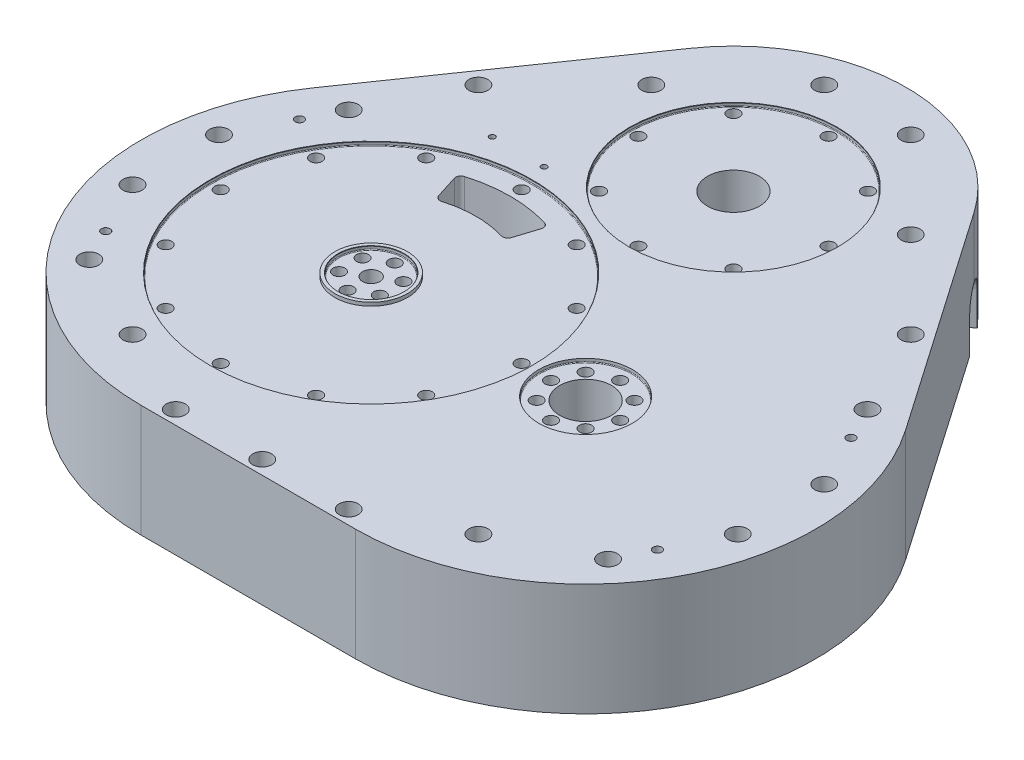
from build123d import *
from OCP.BRepFilletAPI import BRepFilletAPI_MakeChamfer

# Parameters (mm, degrees)
BOSS_EXTRUDE1_DEPTH                           = 63
BOSS_EXTRUDE2_START                           = -2
SKETCH1_4_R                                   = 93.00000000000004
SKETCH1_4_R_2                                 = 24.999999999999996
SKETCH1_4_R_3                                 = 60
SKETCH1_4_R_4                                 = 21.000000000000018
SKETCH1_4_R_5                                 = 19.00000000000001
BOSS_EXTRUDE2_DEPTH                           = 2
SKETCH2_R                                     = 14.999999999999998
SKETCH2_R_2                                   = 5.000000000000004
SKETCH2_R_3                                   = 15.000000000000014
CUT_EXTRUDE1_DEPTH                            = 281.1783027923315
M4_TAPPED_HOLE3_D                             = 3.3
M4_TAPPED_HOLE3_DEPTH                         = 11.5
M4_TAPPED_HOLE3_TIP                           = 0.9914200213954745
MOVE_FACE1_BY                                 = 30
MOVE_FACE1_2_BY                               = 30
MOVE_FACE1_3_BY                               = 30
MOVE_FACE1_4_BY                               = 30
MOVE_FACE1_5_BY                               = 30
MOVE_FACE1_6_BY                               = 30
CUT_EXTRUDE4_DEPTH                            = 30
CBORE_START                                   = -63
CBORE_FOR_M6_HEX_SOCKET_HEAD_CAP_SCR_2_R      = 3.5
CBORE_FOR_M6_HEX_SOCKET_HEAD_CAP_SCREW4_DEPTH = 65
CBORE_START_2                                 = -13
CBORE_FOR_M6_HEX_SOCKET_HEAD_CAP_SCR_3_O_R    = 5.5
CBORE_FOR_M6_HEX_SOCKET_HEAD_CAP_SCR_3_O_R_2  = 3.5
CBORE_FOR_M6_HEX_SOCKET_HEAD_CAP_SCR_3_DEPTH  = 15
CBORE_START_3                                 = -33
CBORE_FOR_M6_HEX_SOCKET_HEAD_CAP_SCR_4_R      = 3.5
CBORE_FOR_M6_HEX_SOCKET_HEAD_CAP_SCREW2_DEPTH = 33
CBORE_FOR_M6_HEX_SOCKET_HEAD_CAP_SCR_5_O_R    = 5.5
CBORE_FOR_M6_HEX_SOCKET_HEAD_CAP_SCR_5_O_R_2  = 3.5
CBORE_FOR_M6_HEX_SOCKET_HEAD_CAP_SCR_5_DEPTH  = 6.4
CUT_EXTRUDE5_DEPTH                            = 30
FILLET1_R                                     = 10
SKETCH25_R                                    = 19.999999999999993
CUT_EXTRUDE7_DEPTH                            = 6.4
M6_TAPPED_HOLE1_D                             = 5
M6_TAPPED_HOLE1_DEPTH                         = 15
M6_TAPPED_HOLE1_TIP                           = 1.5021515475689007
MOVE_FACE3_BY                                 = 2
FILLET3_R                                     = 0.4
CHAMFER2_SIZE                                 = 0.2
CHAMFER2_SIZE2                                = 0.11547005383792547


# Read off the part's stored shape, not the designer's step: CBORE for M6 Hex Socket Head Cap Screw4, CBORE for M6 Hex Socket Head Cap Screw2
with BuildPart() as part:
    # Sketch1 → Boss-Extrude1 (new body)
    with BuildSketch(Plane(origin=(0, 0, 0), x_dir=(1, 0, 0), z_dir=(0, 1, 0))):
        with BuildLine():
            Line((62.000000000000014, -103.00000000000001), (-61.99999999999998, -103.00000000000003))
            ThreePointArc((-61.99999999999998, -103.00000000000003), (-153.23800570835385, -47.79776474232239), (-146.67908218265174, 58.6383239929633))
            Line((-146.67908218265174, 58.6383239929633), (-57.54889080374385, 187.3504406904959))
            ThreePointArc((-57.54889080374385, 187.3504406904959), (4.29e-15, 217.4991525399384), (57.54889080374384, 187.35044069049587))
            Line((57.54889080374384, 187.35044069049587), (146.67908218265168, 58.63832399296319))
            ThreePointArc((146.67908218265168, 58.63832399296319), (153.23800570835382, -47.79776474232238), (62.000000000000014, -103.00000000000001))
        make_face()
        with BuildLine():
            Line((83.01492141423115, 59.99979648260452), (87.21019324490341, 73.30549881526593))
            ThreePointArc((87.21019324490341, 73.30549881526593), (87.00108225288031, 75.61000153165534), (85.21416661430999, 77.08016909947331))
            ThreePointArc((85.21416661430999, 77.08016909947331), (61.999999999999424, 80.50000000000223), (38.78583338568891, 77.08016909947298))
            ThreePointArc((38.78583338568891, 77.08016909947298), (36.99891774711863, 75.61000153165499), (36.78980675509557, 73.3054988152656))
            Line((36.78980675509557, 73.3054988152656), (40.985078585768015, 59.99979648260422))
            ThreePointArc((40.985078585768015, 59.99979648260422), (42.440089302349584, 58.25186295351636), (44.70321309947552, 58.026921880435))
            ThreePointArc((44.70321309947552, 58.026921880435), (61.99999999999958, 60.550000000002264), (79.29678690052367, 58.02692188043525))
            ThreePointArc((79.29678690052367, 58.02692188043525), (81.55991069764961, 58.25186295351663), (83.01492141423115, 59.99979648260452))
        make_face(mode=Mode.SUBTRACT)
    extrude(amount=BOSS_EXTRUDE1_DEPTH)

    # Sketch1<4> → Boss-Extrude2 (add)
    # profile 1 of 2: a face of its own
    with BuildSketch(Plane(origin=(0, 0, 0), x_dir=(1, 0, 0), z_dir=(0, 1, 0)).offset(BOSS_EXTRUDE2_START)):
        with BuildLine():
            ThreePointArc((-57.54889080374385, 187.3504406904959), (4.29e-15, 217.4991525399384), (57.54889080374384, 187.35044069049587))
            Line((57.54889080374384, 187.35044069049587), (146.67908218265168, 58.63832399296319))
            ThreePointArc((146.67908218265168, 58.63832399296319), (153.23800570835382, -47.79776474232238), (62.000000000000014, -103.00000000000001))
            Line((62.000000000000014, -103.00000000000001), (-61.99999999999998, -103.00000000000003))
            ThreePointArc((-61.99999999999998, -103.00000000000003), (-153.23800570835385, -47.79776474232239), (-146.67908218265174, 58.6383239929633))
            Line((-146.67908218265174, 58.6383239929633), (-57.54889080374385, 187.3504406904959))
        make_face()
        with Locations(Location((62, 0, 0), (0, 0, 270))):
            Circle(SKETCH1_4_R, mode=Mode.SUBTRACT)
        with Locations(Location((-61.99999999999999, 6.13e-15, 0), (0, 0, 270))):
            Circle(SKETCH1_4_R_2, mode=Mode.SUBTRACT)
        with Locations(Location((0, 147.49915253993836, 0), (0, 0, 270))):
            Circle(SKETCH1_4_R_3, mode=Mode.SUBTRACT)
    # profile 2 of 2: a face of its own
    with BuildSketch(Plane(origin=(0, 0, 0), x_dir=(1, 0, 0), z_dir=(0, 1, 0)).offset(BOSS_EXTRUDE2_START)):
        with Locations(Location((62, 0, 0), (0, 0, 270))):
            Circle(SKETCH1_4_R_4)
        with Locations(Location((62, 0, 0), (0, 0, 270))):
            Circle(SKETCH1_4_R_5, mode=Mode.SUBTRACT)
    extrude(amount=BOSS_EXTRUDE2_DEPTH)

    # Sketch2 → Cut-Extrude1 (cut, through all)
    with BuildSketch(Plane(origin=(0, 0, 0), x_dir=(1, 0, 0), z_dir=(0, 1, 0))):
        with Locations(Location((-62.00000000000001, 3.79e-15, 0), (0, 0, 270))):
            Circle(SKETCH2_R)
        with Locations(Location((62, 0, 0), (0, 0, 270))):
            Circle(SKETCH2_R_2)
        with Locations(Location((0, 147.49915253993836, 0), (0, 0, 270))):
            Circle(SKETCH2_R_3)
    extrude(amount=CUT_EXTRUDE1_DEPTH, mode=Mode.SUBTRACT)

    # M4 Tapped Hole3
    with Locations(Plane(origin=(0, -2, 0), x_dir=(-1, 0, 0), z_dir=(0, -1, 0))):
        with Locations((-65, 103), (-95, 103)):
            Hole(M4_TAPPED_HOLE3_D / 2, depth=M4_TAPPED_HOLE3_DEPTH)
            with Locations((0, 0, -(M4_TAPPED_HOLE3_DEPTH + M4_TAPPED_HOLE3_TIP / 2))):  # 118° drill point
                Cone(0, M4_TAPPED_HOLE3_D / 2, M4_TAPPED_HOLE3_TIP, mode=Mode.SUBTRACT)


with BuildPart() as body_2:
    # Mirror1: mirrored copy
    add(part.part.mirror(Plane(origin=(0, 0, 0), x_dir=(0, 0, 1), z_dir=(1, 0, 0))))


with BuildPart() as body_3:
    # Mirror2: mirrored copy
    add(body_2.part.mirror(Plane.ZX))

    # Move Face1: a curved face moved outward by 30.0
    add(Solid.thicken(body_3.faces().sort_by_distance((-153.238005708, -30.5, 47.797764742))[0], MOVE_FACE1_BY))

    # Move Face1 2: a face moved outward by 30.0
    extrude(body_3.faces().sort_by_distance((0, -30.5, 103))[0], amount=MOVE_FACE1_2_BY, dir=(0, 0, 1))

    # Move Face1 3: a curved face moved outward by 30.0
    add(Solid.thicken(body_3.faces().sort_by_distance((153.238005708, -30.5, 47.797764742))[0], MOVE_FACE1_3_BY))

    # Move Face1 4: a face moved outward by 30.0
    extrude(body_3.faces().sort_by_distance((102.113986493, -30.5, -122.994382342))[0], amount=MOVE_FACE1_4_BY, dir=(0.822127011, 0, -0.569304116))

    # Move Face1 5: a curved face moved outward by 30.0
    add(Solid.thicken(body_3.faces().sort_by_distance((0, -30.5, -217.49915254))[0], MOVE_FACE1_5_BY))

    # Move Face1 6: a face moved outward by 30.0
    extrude(body_3.faces().sort_by_distance((-102.113986493, -30.5, -122.994382342))[0], amount=MOVE_FACE1_6_BY, dir=(-0.822127011, 0, -0.569304116))

    # Sketch21 → Cut-Extrude4 (cut)
    with BuildSketch(Plane.XZ.offset(63)):
        with BuildLine():
            Line((-57.548890803743824, -187.35044069049584), (-146.67908218265174, -58.638323992963166))
            ThreePointArc((-146.67908218265174, -58.638323992963166), (-153.23800570835382, 47.797764742322386), (-62.000000000000014, 103.00000000000001))
            Line((-62.000000000000014, 103.00000000000001), (62.00000000000004, 103.00000000000001))
            ThreePointArc((62.00000000000004, 103.00000000000001), (153.2380057083539, 47.79776474232241), (146.67908218265174, -58.638323992963244))
            Line((146.67908218265174, -58.638323992963244), (57.548890803743845, -187.3504406904959))
            ThreePointArc((57.548890803743845, -187.3504406904959), (-2.68e-14, -217.49915253993834), (-57.548890803743824, -187.35044069049584))
        make_face()
    extrude(amount=-CUT_EXTRUDE4_DEPTH, mode=Mode.SUBTRACT)

    # CBORE for M6 Hex Socket Head Cap Scr 2 → CBORE for M6 Hex Socket Head Cap Screw4 (cut)
    with BuildSketch(Plane(origin=(0, 0, 0), x_dir=(1, 0, 0), z_dir=(0, 1, 0)).offset(CBORE_START)):
        with Locations((25, 225)):
            Circle(CBORE_FOR_M6_HEX_SOCKET_HEAD_CAP_SCR_2_R)
        with Locations((-25, 225)):
            Circle(CBORE_FOR_M6_HEX_SOCKET_HEAD_CAP_SCR_2_R)
        with Locations((-175, 25)):
            Circle(CBORE_FOR_M6_HEX_SOCKET_HEAD_CAP_SCR_2_R)
        with Locations((-175, -25)):
            Circle(CBORE_FOR_M6_HEX_SOCKET_HEAD_CAP_SCR_2_R)
        with Locations((75, 175)):
            Circle(CBORE_FOR_M6_HEX_SOCKET_HEAD_CAP_SCR_2_R)
        with Locations((-75, 175)):
            Circle(CBORE_FOR_M6_HEX_SOCKET_HEAD_CAP_SCR_2_R)
        with Locations((125, 125)):
            Circle(CBORE_FOR_M6_HEX_SOCKET_HEAD_CAP_SCR_2_R)
        with Locations((-125, 125)):
            Circle(CBORE_FOR_M6_HEX_SOCKET_HEAD_CAP_SCR_2_R)
        with Locations((150, 75)):
            Circle(CBORE_FOR_M6_HEX_SOCKET_HEAD_CAP_SCR_2_R)
        with Locations((-150, 75)):
            Circle(CBORE_FOR_M6_HEX_SOCKET_HEAD_CAP_SCR_2_R)
        with Locations((175, 25)):
            Circle(CBORE_FOR_M6_HEX_SOCKET_HEAD_CAP_SCR_2_R)
        with Locations((175, -25)):
            Circle(CBORE_FOR_M6_HEX_SOCKET_HEAD_CAP_SCR_2_R)
        with Locations((150, -75)):
            Circle(CBORE_FOR_M6_HEX_SOCKET_HEAD_CAP_SCR_2_R)
        with Locations((-150, -75)):
            Circle(CBORE_FOR_M6_HEX_SOCKET_HEAD_CAP_SCR_2_R)
        with Locations((100, -100)):
            Circle(CBORE_FOR_M6_HEX_SOCKET_HEAD_CAP_SCR_2_R)
        with Locations((-100, -100)):
            Circle(CBORE_FOR_M6_HEX_SOCKET_HEAD_CAP_SCR_2_R)
        with Locations((50, -125)):
            Circle(CBORE_FOR_M6_HEX_SOCKET_HEAD_CAP_SCR_2_R)
        with Locations((0, -125)):
            Circle(CBORE_FOR_M6_HEX_SOCKET_HEAD_CAP_SCR_2_R)
        with Locations((-50, -125)):
            Circle(CBORE_FOR_M6_HEX_SOCKET_HEAD_CAP_SCR_2_R)
    extrude(amount=CBORE_FOR_M6_HEX_SOCKET_HEAD_CAP_SCREW4_DEPTH, mode=Mode.SUBTRACT)

    # CBORE for M6 Hex Socket Head Cap Scr 3 o → CBORE for M6 Hex Socket Head Cap Scr 3 (cut)
    # profile 1 of 19: a face of its own
    with BuildSketch(Plane(origin=(0, 0, 0), x_dir=(1, 0, 0), z_dir=(0, 1, 0)).offset(CBORE_START_2)):
        with Locations((25, 225)):
            Circle(CBORE_FOR_M6_HEX_SOCKET_HEAD_CAP_SCR_3_O_R)
        with Locations((25, 225)):
            Circle(CBORE_FOR_M6_HEX_SOCKET_HEAD_CAP_SCR_3_O_R_2, mode=Mode.SUBTRACT)
    # profile 2 of 19: a face of its own
    with BuildSketch(Plane(origin=(0, 0, 0), x_dir=(1, 0, 0), z_dir=(0, 1, 0)).offset(CBORE_START_2)):
        with Locations((-25, 225)):
            Circle(CBORE_FOR_M6_HEX_SOCKET_HEAD_CAP_SCR_3_O_R)
        with Locations((-25, 225)):
            Circle(CBORE_FOR_M6_HEX_SOCKET_HEAD_CAP_SCR_3_O_R_2, mode=Mode.SUBTRACT)
    # profile 3 of 19: a face of its own
    with BuildSketch(Plane(origin=(0, 0, 0), x_dir=(1, 0, 0), z_dir=(0, 1, 0)).offset(CBORE_START_2)):
        with Locations((-175, 25)):
            Circle(CBORE_FOR_M6_HEX_SOCKET_HEAD_CAP_SCR_3_O_R)
        with Locations((-175, 25)):
            Circle(CBORE_FOR_M6_HEX_SOCKET_HEAD_CAP_SCR_3_O_R_2, mode=Mode.SUBTRACT)
    # profile 4 of 19: a face of its own
    with BuildSketch(Plane(origin=(0, 0, 0), x_dir=(1, 0, 0), z_dir=(0, 1, 0)).offset(CBORE_START_2)):
        with Locations((-175, -25)):
            Circle(CBORE_FOR_M6_HEX_SOCKET_HEAD_CAP_SCR_3_O_R)
        with Locations((-175, -25)):
            Circle(CBORE_FOR_M6_HEX_SOCKET_HEAD_CAP_SCR_3_O_R_2, mode=Mode.SUBTRACT)
    # profile 5 of 19: a face of its own
    with BuildSketch(Plane(origin=(0, 0, 0), x_dir=(1, 0, 0), z_dir=(0, 1, 0)).offset(CBORE_START_2)):
        with Locations((75, 175)):
            Circle(CBORE_FOR_M6_HEX_SOCKET_HEAD_CAP_SCR_3_O_R)
        with Locations((75, 175)):
            Circle(CBORE_FOR_M6_HEX_SOCKET_HEAD_CAP_SCR_3_O_R_2, mode=Mode.SUBTRACT)
    # profile 6 of 19: a face of its own
    with BuildSketch(Plane(origin=(0, 0, 0), x_dir=(1, 0, 0), z_dir=(0, 1, 0)).offset(CBORE_START_2)):
        with Locations((-75, 175)):
            Circle(CBORE_FOR_M6_HEX_SOCKET_HEAD_CAP_SCR_3_O_R)
        with Locations((-75, 175)):
            Circle(CBORE_FOR_M6_HEX_SOCKET_HEAD_CAP_SCR_3_O_R_2, mode=Mode.SUBTRACT)
    # profile 7 of 19: a face of its own
    with BuildSketch(Plane(origin=(0, 0, 0), x_dir=(1, 0, 0), z_dir=(0, 1, 0)).offset(CBORE_START_2)):
        with Locations((125, 125)):
            Circle(CBORE_FOR_M6_HEX_SOCKET_HEAD_CAP_SCR_3_O_R)
        with Locations((125, 125)):
            Circle(CBORE_FOR_M6_HEX_SOCKET_HEAD_CAP_SCR_3_O_R_2, mode=Mode.SUBTRACT)
    # profile 8 of 19: a face of its own
    with BuildSketch(Plane(origin=(0, 0, 0), x_dir=(1, 0, 0), z_dir=(0, 1, 0)).offset(CBORE_START_2)):
        with Locations((-125, 125)):
            Circle(CBORE_FOR_M6_HEX_SOCKET_HEAD_CAP_SCR_3_O_R)
        with Locations((-125, 125)):
            Circle(CBORE_FOR_M6_HEX_SOCKET_HEAD_CAP_SCR_3_O_R_2, mode=Mode.SUBTRACT)
    # profile 9 of 19: a face of its own
    with BuildSketch(Plane(origin=(0, 0, 0), x_dir=(1, 0, 0), z_dir=(0, 1, 0)).offset(CBORE_START_2)):
        with Locations((150, 75)):
            Circle(CBORE_FOR_M6_HEX_SOCKET_HEAD_CAP_SCR_3_O_R)
        with Locations((150, 75)):
            Circle(CBORE_FOR_M6_HEX_SOCKET_HEAD_CAP_SCR_3_O_R_2, mode=Mode.SUBTRACT)
    # profile 10 of 19: a face of its own
    with BuildSketch(Plane(origin=(0, 0, 0), x_dir=(1, 0, 0), z_dir=(0, 1, 0)).offset(CBORE_START_2)):
        with Locations((-150, 75)):
            Circle(CBORE_FOR_M6_HEX_SOCKET_HEAD_CAP_SCR_3_O_R)
        with Locations((-150, 75)):
            Circle(CBORE_FOR_M6_HEX_SOCKET_HEAD_CAP_SCR_3_O_R_2, mode=Mode.SUBTRACT)
    # profile 11 of 19: a face of its own
    with BuildSketch(Plane(origin=(0, 0, 0), x_dir=(1, 0, 0), z_dir=(0, 1, 0)).offset(CBORE_START_2)):
        with Locations((175, 25)):
            Circle(CBORE_FOR_M6_HEX_SOCKET_HEAD_CAP_SCR_3_O_R)
        with Locations((175, 25)):
            Circle(CBORE_FOR_M6_HEX_SOCKET_HEAD_CAP_SCR_3_O_R_2, mode=Mode.SUBTRACT)
    # profile 12 of 19: a face of its own
    with BuildSketch(Plane(origin=(0, 0, 0), x_dir=(1, 0, 0), z_dir=(0, 1, 0)).offset(CBORE_START_2)):
        with Locations((175, -25)):
            Circle(CBORE_FOR_M6_HEX_SOCKET_HEAD_CAP_SCR_3_O_R)
        with Locations((175, -25)):
            Circle(CBORE_FOR_M6_HEX_SOCKET_HEAD_CAP_SCR_3_O_R_2, mode=Mode.SUBTRACT)
    # profile 13 of 19: a face of its own
    with BuildSketch(Plane(origin=(0, 0, 0), x_dir=(1, 0, 0), z_dir=(0, 1, 0)).offset(CBORE_START_2)):
        with Locations((150, -75)):
            Circle(CBORE_FOR_M6_HEX_SOCKET_HEAD_CAP_SCR_3_O_R)
        with Locations((150, -75)):
            Circle(CBORE_FOR_M6_HEX_SOCKET_HEAD_CAP_SCR_3_O_R_2, mode=Mode.SUBTRACT)
    # profile 14 of 19: a face of its own
    with BuildSketch(Plane(origin=(0, 0, 0), x_dir=(1, 0, 0), z_dir=(0, 1, 0)).offset(CBORE_START_2)):
        with Locations((-150, -75)):
            Circle(CBORE_FOR_M6_HEX_SOCKET_HEAD_CAP_SCR_3_O_R)
        with Locations((-150, -75)):
            Circle(CBORE_FOR_M6_HEX_SOCKET_HEAD_CAP_SCR_3_O_R_2, mode=Mode.SUBTRACT)
    # profile 15 of 19: a face of its own
    with BuildSketch(Plane(origin=(0, 0, 0), x_dir=(1, 0, 0), z_dir=(0, 1, 0)).offset(CBORE_START_2)):
        with Locations((100, -100)):
            Circle(CBORE_FOR_M6_HEX_SOCKET_HEAD_CAP_SCR_3_O_R)
        with Locations((100, -100)):
            Circle(CBORE_FOR_M6_HEX_SOCKET_HEAD_CAP_SCR_3_O_R_2, mode=Mode.SUBTRACT)
    # profile 16 of 19: a face of its own
    with BuildSketch(Plane(origin=(0, 0, 0), x_dir=(1, 0, 0), z_dir=(0, 1, 0)).offset(CBORE_START_2)):
        with Locations((-100, -100)):
            Circle(CBORE_FOR_M6_HEX_SOCKET_HEAD_CAP_SCR_3_O_R)
        with Locations((-100, -100)):
            Circle(CBORE_FOR_M6_HEX_SOCKET_HEAD_CAP_SCR_3_O_R_2, mode=Mode.SUBTRACT)
    # profile 17 of 19: a face of its own
    with BuildSketch(Plane(origin=(0, 0, 0), x_dir=(1, 0, 0), z_dir=(0, 1, 0)).offset(CBORE_START_2)):
        with Locations((50, -125)):
            Circle(CBORE_FOR_M6_HEX_SOCKET_HEAD_CAP_SCR_3_O_R)
        with Locations((50, -125)):
            Circle(CBORE_FOR_M6_HEX_SOCKET_HEAD_CAP_SCR_3_O_R_2, mode=Mode.SUBTRACT)
    # profile 18 of 19: a face of its own
    with BuildSketch(Plane(origin=(0, 0, 0), x_dir=(1, 0, 0), z_dir=(0, 1, 0)).offset(CBORE_START_2)):
        with Locations((0, -125)):
            Circle(CBORE_FOR_M6_HEX_SOCKET_HEAD_CAP_SCR_3_O_R)
        with Locations((0, -125)):
            Circle(CBORE_FOR_M6_HEX_SOCKET_HEAD_CAP_SCR_3_O_R_2, mode=Mode.SUBTRACT)
    # profile 19 of 19: a face of its own
    with BuildSketch(Plane(origin=(0, 0, 0), x_dir=(1, 0, 0), z_dir=(0, 1, 0)).offset(CBORE_START_2)):
        with Locations((-50, -125)):
            Circle(CBORE_FOR_M6_HEX_SOCKET_HEAD_CAP_SCR_3_O_R)
        with Locations((-50, -125)):
            Circle(CBORE_FOR_M6_HEX_SOCKET_HEAD_CAP_SCR_3_O_R_2, mode=Mode.SUBTRACT)
    extrude(amount=CBORE_FOR_M6_HEX_SOCKET_HEAD_CAP_SCR_3_DEPTH, mode=Mode.SUBTRACT)

    # CBORE for M6 Hex Socket Head Cap Scr 4 → CBORE for M6 Hex Socket Head Cap Screw2 (cut)
    with BuildSketch(Plane(origin=(0, 0, 0), x_dir=(1, 0, 0), z_dir=(0, 1, 0)).offset(CBORE_START_3)):
        with Locations((0, 202.49915254)):
            Circle(CBORE_FOR_M6_HEX_SOCKET_HEAD_CAP_SCR_4_R)
        with Locations((38.890872965, 186.390025505)):
            Circle(CBORE_FOR_M6_HEX_SOCKET_HEAD_CAP_SCR_4_R)
        with Locations((55, 147.49915254)):
            Circle(CBORE_FOR_M6_HEX_SOCKET_HEAD_CAP_SCR_4_R)
        with Locations((38.890872965, 108.608279575)):
            Circle(CBORE_FOR_M6_HEX_SOCKET_HEAD_CAP_SCR_4_R)
        with Locations((0, 92.49915254)):
            Circle(CBORE_FOR_M6_HEX_SOCKET_HEAD_CAP_SCR_4_R)
        with Locations((-38.890872965, 108.608279575)):
            Circle(CBORE_FOR_M6_HEX_SOCKET_HEAD_CAP_SCR_4_R)
        with Locations((-55, 147.49915254)):
            Circle(CBORE_FOR_M6_HEX_SOCKET_HEAD_CAP_SCR_4_R)
        with Locations((-38.890872965, 186.390025505)):
            Circle(CBORE_FOR_M6_HEX_SOCKET_HEAD_CAP_SCR_4_R)
        with Locations((13.344210129, 43.5)):
            Circle(CBORE_FOR_M6_HEX_SOCKET_HEAD_CAP_SCR_4_R)
        with Locations((-18.5, 75.344210129)):
            Circle(CBORE_FOR_M6_HEX_SOCKET_HEAD_CAP_SCR_4_R)
        with Locations((25, 0)):
            Circle(CBORE_FOR_M6_HEX_SOCKET_HEAD_CAP_SCR_4_R)
        with Locations((13.344210129, -43.5)):
            Circle(CBORE_FOR_M6_HEX_SOCKET_HEAD_CAP_SCR_4_R)
        with Locations((-18.5, -75.344210129)):
            Circle(CBORE_FOR_M6_HEX_SOCKET_HEAD_CAP_SCR_4_R)
        with Locations((-62, -87)):
            Circle(CBORE_FOR_M6_HEX_SOCKET_HEAD_CAP_SCR_4_R)
        with Locations((-105.5, -75.344210129)):
            Circle(CBORE_FOR_M6_HEX_SOCKET_HEAD_CAP_SCR_4_R)
        with Locations((-62, 87)):
            Circle(CBORE_FOR_M6_HEX_SOCKET_HEAD_CAP_SCR_4_R)
        with Locations((-105.5, 75.344210129)):
            Circle(CBORE_FOR_M6_HEX_SOCKET_HEAD_CAP_SCR_4_R)
        with Locations((-137.344210129, -43.5)):
            Circle(CBORE_FOR_M6_HEX_SOCKET_HEAD_CAP_SCR_4_R)
        with Locations((-149, 0)):
            Circle(CBORE_FOR_M6_HEX_SOCKET_HEAD_CAP_SCR_4_R)
        with Locations((-137.344210129, 43.5)):
            Circle(CBORE_FOR_M6_HEX_SOCKET_HEAD_CAP_SCR_4_R)
        with Locations((-73.7966538, -6.810801247)):
            Circle(CBORE_FOR_M6_HEX_SOCKET_HEAD_CAP_SCR_4_R)
        with Locations((-62, -13.621602494)):
            Circle(CBORE_FOR_M6_HEX_SOCKET_HEAD_CAP_SCR_4_R)
        with Locations((-50.2033462, -6.810801247)):
            Circle(CBORE_FOR_M6_HEX_SOCKET_HEAD_CAP_SCR_4_R)
        with Locations((-50.2033462, 6.810801247)):
            Circle(CBORE_FOR_M6_HEX_SOCKET_HEAD_CAP_SCR_4_R)
        with Locations((-62, 13.621602494)):
            Circle(CBORE_FOR_M6_HEX_SOCKET_HEAD_CAP_SCR_4_R)
        with Locations((-73.7966538, 6.810801247)):
            Circle(CBORE_FOR_M6_HEX_SOCKET_HEAD_CAP_SCR_4_R)
        with Locations((47.857864376, -14.142135624)):
            Circle(CBORE_FOR_M6_HEX_SOCKET_HEAD_CAP_SCR_4_R)
        with Locations((62, -20)):
            Circle(CBORE_FOR_M6_HEX_SOCKET_HEAD_CAP_SCR_4_R)
        with Locations((76.142135624, -14.142135624)):
            Circle(CBORE_FOR_M6_HEX_SOCKET_HEAD_CAP_SCR_4_R)
        with Locations((82, 0)):
            Circle(CBORE_FOR_M6_HEX_SOCKET_HEAD_CAP_SCR_4_R)
        with Locations((76.142135624, 14.142135624)):
            Circle(CBORE_FOR_M6_HEX_SOCKET_HEAD_CAP_SCR_4_R)
        with Locations((62, 20)):
            Circle(CBORE_FOR_M6_HEX_SOCKET_HEAD_CAP_SCR_4_R)
        with Locations((47.857864376, 14.142135624)):
            Circle(CBORE_FOR_M6_HEX_SOCKET_HEAD_CAP_SCR_4_R)
        with Locations((42, 0)):
            Circle(CBORE_FOR_M6_HEX_SOCKET_HEAD_CAP_SCR_4_R)
    extrude(amount=CBORE_FOR_M6_HEX_SOCKET_HEAD_CAP_SCREW2_DEPTH, mode=Mode.SUBTRACT)

    # CBORE for M6 Hex Socket Head Cap Scr 5 o → CBORE for M6 Hex Socket Head Cap Scr 5 (cut)
    # profile 1 of 34: a face of its own
    with BuildSketch(Plane(origin=(0, 0, 0), x_dir=(1, 0, 0), z_dir=(0, 1, 0)).offset(CBORE_START_3)):
        with Locations((0, 202.49915254)):
            Circle(CBORE_FOR_M6_HEX_SOCKET_HEAD_CAP_SCR_5_O_R)
        with Locations((0, 202.49915254)):
            Circle(CBORE_FOR_M6_HEX_SOCKET_HEAD_CAP_SCR_5_O_R_2, mode=Mode.SUBTRACT)
    # profile 2 of 34: a face of its own
    with BuildSketch(Plane(origin=(0, 0, 0), x_dir=(1, 0, 0), z_dir=(0, 1, 0)).offset(CBORE_START_3)):
        with Locations((38.890872965, 186.390025505)):
            Circle(CBORE_FOR_M6_HEX_SOCKET_HEAD_CAP_SCR_5_O_R)
        with Locations((38.890872965, 186.390025505)):
            Circle(CBORE_FOR_M6_HEX_SOCKET_HEAD_CAP_SCR_5_O_R_2, mode=Mode.SUBTRACT)
    # profile 3 of 34: a face of its own
    with BuildSketch(Plane(origin=(0, 0, 0), x_dir=(1, 0, 0), z_dir=(0, 1, 0)).offset(CBORE_START_3)):
        with Locations((55, 147.49915254)):
            Circle(CBORE_FOR_M6_HEX_SOCKET_HEAD_CAP_SCR_5_O_R)
        with Locations((55, 147.49915254)):
            Circle(CBORE_FOR_M6_HEX_SOCKET_HEAD_CAP_SCR_5_O_R_2, mode=Mode.SUBTRACT)
    # profile 4 of 34: a face of its own
    with BuildSketch(Plane(origin=(0, 0, 0), x_dir=(1, 0, 0), z_dir=(0, 1, 0)).offset(CBORE_START_3)):
        with Locations((38.890872965, 108.608279575)):
            Circle(CBORE_FOR_M6_HEX_SOCKET_HEAD_CAP_SCR_5_O_R)
        with Locations((38.890872965, 108.608279575)):
            Circle(CBORE_FOR_M6_HEX_SOCKET_HEAD_CAP_SCR_5_O_R_2, mode=Mode.SUBTRACT)
    # profile 5 of 34: a face of its own
    with BuildSketch(Plane(origin=(0, 0, 0), x_dir=(1, 0, 0), z_dir=(0, 1, 0)).offset(CBORE_START_3)):
        with Locations((0, 92.49915254)):
            Circle(CBORE_FOR_M6_HEX_SOCKET_HEAD_CAP_SCR_5_O_R)
        with Locations((0, 92.49915254)):
            Circle(CBORE_FOR_M6_HEX_SOCKET_HEAD_CAP_SCR_5_O_R_2, mode=Mode.SUBTRACT)
    # profile 6 of 34: a face of its own
    with BuildSketch(Plane(origin=(0, 0, 0), x_dir=(1, 0, 0), z_dir=(0, 1, 0)).offset(CBORE_START_3)):
        with Locations((-38.890872965, 108.608279575)):
            Circle(CBORE_FOR_M6_HEX_SOCKET_HEAD_CAP_SCR_5_O_R)
        with Locations((-38.890872965, 108.608279575)):
            Circle(CBORE_FOR_M6_HEX_SOCKET_HEAD_CAP_SCR_5_O_R_2, mode=Mode.SUBTRACT)
    # profile 7 of 34: a face of its own
    with BuildSketch(Plane(origin=(0, 0, 0), x_dir=(1, 0, 0), z_dir=(0, 1, 0)).offset(CBORE_START_3)):
        with Locations((-55, 147.49915254)):
            Circle(CBORE_FOR_M6_HEX_SOCKET_HEAD_CAP_SCR_5_O_R)
        with Locations((-55, 147.49915254)):
            Circle(CBORE_FOR_M6_HEX_SOCKET_HEAD_CAP_SCR_5_O_R_2, mode=Mode.SUBTRACT)
    # profile 8 of 34: a face of its own
    with BuildSketch(Plane(origin=(0, 0, 0), x_dir=(1, 0, 0), z_dir=(0, 1, 0)).offset(CBORE_START_3)):
        with Locations((-38.890872965, 186.390025505)):
            Circle(CBORE_FOR_M6_HEX_SOCKET_HEAD_CAP_SCR_5_O_R)
        with Locations((-38.890872965, 186.390025505)):
            Circle(CBORE_FOR_M6_HEX_SOCKET_HEAD_CAP_SCR_5_O_R_2, mode=Mode.SUBTRACT)
    # profile 9 of 34: a face of its own
    with BuildSketch(Plane(origin=(0, 0, 0), x_dir=(1, 0, 0), z_dir=(0, 1, 0)).offset(CBORE_START_3)):
        with Locations((13.344210129, 43.5)):
            Circle(CBORE_FOR_M6_HEX_SOCKET_HEAD_CAP_SCR_5_O_R)
        with Locations((13.344210129, 43.5)):
            Circle(CBORE_FOR_M6_HEX_SOCKET_HEAD_CAP_SCR_5_O_R_2, mode=Mode.SUBTRACT)
    # profile 10 of 34: a face of its own
    with BuildSketch(Plane(origin=(0, 0, 0), x_dir=(1, 0, 0), z_dir=(0, 1, 0)).offset(CBORE_START_3)):
        with Locations((-18.5, 75.344210129)):
            Circle(CBORE_FOR_M6_HEX_SOCKET_HEAD_CAP_SCR_5_O_R)
        with Locations((-18.5, 75.344210129)):
            Circle(CBORE_FOR_M6_HEX_SOCKET_HEAD_CAP_SCR_5_O_R_2, mode=Mode.SUBTRACT)
    # profile 11 of 34: a face of its own
    with BuildSketch(Plane(origin=(0, 0, 0), x_dir=(1, 0, 0), z_dir=(0, 1, 0)).offset(CBORE_START_3)):
        with Locations((25, 0)):
            Circle(CBORE_FOR_M6_HEX_SOCKET_HEAD_CAP_SCR_5_O_R)
        with Locations((25, 0)):
            Circle(CBORE_FOR_M6_HEX_SOCKET_HEAD_CAP_SCR_5_O_R_2, mode=Mode.SUBTRACT)
    # profile 12 of 34: a face of its own
    with BuildSketch(Plane(origin=(0, 0, 0), x_dir=(1, 0, 0), z_dir=(0, 1, 0)).offset(CBORE_START_3)):
        with Locations((13.344210129, -43.5)):
            Circle(CBORE_FOR_M6_HEX_SOCKET_HEAD_CAP_SCR_5_O_R)
        with Locations((13.344210129, -43.5)):
            Circle(CBORE_FOR_M6_HEX_SOCKET_HEAD_CAP_SCR_5_O_R_2, mode=Mode.SUBTRACT)
    # profile 13 of 34: a face of its own
    with BuildSketch(Plane(origin=(0, 0, 0), x_dir=(1, 0, 0), z_dir=(0, 1, 0)).offset(CBORE_START_3)):
        with Locations((-18.5, -75.344210129)):
            Circle(CBORE_FOR_M6_HEX_SOCKET_HEAD_CAP_SCR_5_O_R)
        with Locations((-18.5, -75.344210129)):
            Circle(CBORE_FOR_M6_HEX_SOCKET_HEAD_CAP_SCR_5_O_R_2, mode=Mode.SUBTRACT)
    # profile 14 of 34: a face of its own
    with BuildSketch(Plane(origin=(0, 0, 0), x_dir=(1, 0, 0), z_dir=(0, 1, 0)).offset(CBORE_START_3)):
        with Locations((-62, -87)):
            Circle(CBORE_FOR_M6_HEX_SOCKET_HEAD_CAP_SCR_5_O_R)
        with Locations((-62, -87)):
            Circle(CBORE_FOR_M6_HEX_SOCKET_HEAD_CAP_SCR_5_O_R_2, mode=Mode.SUBTRACT)
    # profile 15 of 34: a face of its own
    with BuildSketch(Plane(origin=(0, 0, 0), x_dir=(1, 0, 0), z_dir=(0, 1, 0)).offset(CBORE_START_3)):
        with Locations((-105.5, -75.344210129)):
            Circle(CBORE_FOR_M6_HEX_SOCKET_HEAD_CAP_SCR_5_O_R)
        with Locations((-105.5, -75.344210129)):
            Circle(CBORE_FOR_M6_HEX_SOCKET_HEAD_CAP_SCR_5_O_R_2, mode=Mode.SUBTRACT)
    # profile 16 of 34: a face of its own
    with BuildSketch(Plane(origin=(0, 0, 0), x_dir=(1, 0, 0), z_dir=(0, 1, 0)).offset(CBORE_START_3)):
        with Locations((-62, 87)):
            Circle(CBORE_FOR_M6_HEX_SOCKET_HEAD_CAP_SCR_5_O_R)
        with Locations((-62, 87)):
            Circle(CBORE_FOR_M6_HEX_SOCKET_HEAD_CAP_SCR_5_O_R_2, mode=Mode.SUBTRACT)
    # profile 17 of 34: a face of its own
    with BuildSketch(Plane(origin=(0, 0, 0), x_dir=(1, 0, 0), z_dir=(0, 1, 0)).offset(CBORE_START_3)):
        with Locations((-105.5, 75.344210129)):
            Circle(CBORE_FOR_M6_HEX_SOCKET_HEAD_CAP_SCR_5_O_R)
        with Locations((-105.5, 75.344210129)):
            Circle(CBORE_FOR_M6_HEX_SOCKET_HEAD_CAP_SCR_5_O_R_2, mode=Mode.SUBTRACT)
    # profile 18 of 34: a face of its own
    with BuildSketch(Plane(origin=(0, 0, 0), x_dir=(1, 0, 0), z_dir=(0, 1, 0)).offset(CBORE_START_3)):
        with Locations((-137.344210129, -43.5)):
            Circle(CBORE_FOR_M6_HEX_SOCKET_HEAD_CAP_SCR_5_O_R)
        with Locations((-137.344210129, -43.5)):
            Circle(CBORE_FOR_M6_HEX_SOCKET_HEAD_CAP_SCR_5_O_R_2, mode=Mode.SUBTRACT)
    # profile 19 of 34: a face of its own
    with BuildSketch(Plane(origin=(0, 0, 0), x_dir=(1, 0, 0), z_dir=(0, 1, 0)).offset(CBORE_START_3)):
        with Locations((-149, 0)):
            Circle(CBORE_FOR_M6_HEX_SOCKET_HEAD_CAP_SCR_5_O_R)
        with Locations((-149, 0)):
            Circle(CBORE_FOR_M6_HEX_SOCKET_HEAD_CAP_SCR_5_O_R_2, mode=Mode.SUBTRACT)
    # profile 20 of 34: a face of its own
    with BuildSketch(Plane(origin=(0, 0, 0), x_dir=(1, 0, 0), z_dir=(0, 1, 0)).offset(CBORE_START_3)):
        with Locations((-137.344210129, 43.5)):
            Circle(CBORE_FOR_M6_HEX_SOCKET_HEAD_CAP_SCR_5_O_R)
        with Locations((-137.344210129, 43.5)):
            Circle(CBORE_FOR_M6_HEX_SOCKET_HEAD_CAP_SCR_5_O_R_2, mode=Mode.SUBTRACT)
    # profile 21 of 34: a face of its own
    with BuildSketch(Plane(origin=(0, 0, 0), x_dir=(1, 0, 0), z_dir=(0, 1, 0)).offset(CBORE_START_3)):
        with Locations((-73.7966538, -6.810801247)):
            Circle(CBORE_FOR_M6_HEX_SOCKET_HEAD_CAP_SCR_5_O_R)
        with Locations((-73.7966538, -6.810801247)):
            Circle(CBORE_FOR_M6_HEX_SOCKET_HEAD_CAP_SCR_5_O_R_2, mode=Mode.SUBTRACT)
    # profile 22 of 34: a face of its own
    with BuildSketch(Plane(origin=(0, 0, 0), x_dir=(1, 0, 0), z_dir=(0, 1, 0)).offset(CBORE_START_3)):
        with Locations((-62, -13.621602494)):
            Circle(CBORE_FOR_M6_HEX_SOCKET_HEAD_CAP_SCR_5_O_R)
        with Locations((-62, -13.621602494)):
            Circle(CBORE_FOR_M6_HEX_SOCKET_HEAD_CAP_SCR_5_O_R_2, mode=Mode.SUBTRACT)
    # profile 23 of 34: a face of its own
    with BuildSketch(Plane(origin=(0, 0, 0), x_dir=(1, 0, 0), z_dir=(0, 1, 0)).offset(CBORE_START_3)):
        with Locations((-50.2033462, -6.810801247)):
            Circle(CBORE_FOR_M6_HEX_SOCKET_HEAD_CAP_SCR_5_O_R)
        with Locations((-50.2033462, -6.810801247)):
            Circle(CBORE_FOR_M6_HEX_SOCKET_HEAD_CAP_SCR_5_O_R_2, mode=Mode.SUBTRACT)
    # profile 24 of 34: a face of its own
    with BuildSketch(Plane(origin=(0, 0, 0), x_dir=(1, 0, 0), z_dir=(0, 1, 0)).offset(CBORE_START_3)):
        with Locations((-50.2033462, 6.810801247)):
            Circle(CBORE_FOR_M6_HEX_SOCKET_HEAD_CAP_SCR_5_O_R)
        with Locations((-50.2033462, 6.810801247)):
            Circle(CBORE_FOR_M6_HEX_SOCKET_HEAD_CAP_SCR_5_O_R_2, mode=Mode.SUBTRACT)
    # profile 25 of 34: a face of its own
    with BuildSketch(Plane(origin=(0, 0, 0), x_dir=(1, 0, 0), z_dir=(0, 1, 0)).offset(CBORE_START_3)):
        with Locations((-62, 13.621602494)):
            Circle(CBORE_FOR_M6_HEX_SOCKET_HEAD_CAP_SCR_5_O_R)
        with Locations((-62, 13.621602494)):
            Circle(CBORE_FOR_M6_HEX_SOCKET_HEAD_CAP_SCR_5_O_R_2, mode=Mode.SUBTRACT)
    # profile 26 of 34: a face of its own
    with BuildSketch(Plane(origin=(0, 0, 0), x_dir=(1, 0, 0), z_dir=(0, 1, 0)).offset(CBORE_START_3)):
        with Locations((-73.7966538, 6.810801247)):
            Circle(CBORE_FOR_M6_HEX_SOCKET_HEAD_CAP_SCR_5_O_R)
        with Locations((-73.7966538, 6.810801247)):
            Circle(CBORE_FOR_M6_HEX_SOCKET_HEAD_CAP_SCR_5_O_R_2, mode=Mode.SUBTRACT)
    # profile 27 of 34: a face of its own
    with BuildSketch(Plane(origin=(0, 0, 0), x_dir=(1, 0, 0), z_dir=(0, 1, 0)).offset(CBORE_START_3)):
        with BuildLine():
            ThreePointArc((50.08615722, -9.113745125), (43.96877708, -18.03122292), (52.886254875, -11.91384278))
            ThreePointArc((52.886254875, -11.91384278), (51.393398282, -10.606601718), (50.08615722, -9.113745125))
        make_face()
        with Locations((47.857864376, -14.142135624)):
            Circle(CBORE_FOR_M6_HEX_SOCKET_HEAD_CAP_SCR_5_O_R_2, mode=Mode.SUBTRACT)
    # profile 28 of 34: a face of its own
    with BuildSketch(Plane(origin=(0, 0, 0), x_dir=(1, 0, 0), z_dir=(0, 1, 0)).offset(CBORE_START_3)):
        with BuildLine():
            ThreePointArc((63.97996804, -14.86875), (62, -15), (60.02003196, -14.86875))
            ThreePointArc((60.02003196, -14.86875), (62, -25.5), (63.97996804, -14.86875))
        make_face()
        with Locations((62, -20)):
            Circle(CBORE_FOR_M6_HEX_SOCKET_HEAD_CAP_SCR_5_O_R_2, mode=Mode.SUBTRACT)
    # profile 29 of 34: a face of its own
    with BuildSketch(Plane(origin=(0, 0, 0), x_dir=(1, 0, 0), z_dir=(0, 1, 0)).offset(CBORE_START_3)):
        with BuildLine():
            ThreePointArc((47.13125, 1.97996804), (36.5, 0), (47.13125, -1.97996804))
            ThreePointArc((47.13125, -1.97996804), (47, 0), (47.13125, 1.97996804))
        make_face()
        with Locations((42, 0)):
            Circle(CBORE_FOR_M6_HEX_SOCKET_HEAD_CAP_SCR_5_O_R_2, mode=Mode.SUBTRACT)
    # profile 30 of 34: a face of its own
    with BuildSketch(Plane(origin=(0, 0, 0), x_dir=(1, 0, 0), z_dir=(0, 1, 0)).offset(CBORE_START_3)):
        with BuildLine():
            ThreePointArc((73.91384278, -9.113745125), (72.606601718, -10.606601718), (71.113745125, -11.91384278))
            ThreePointArc((71.113745125, -11.91384278), (80.03122292, -18.03122292), (73.91384278, -9.113745125))
        make_face()
        with Locations((76.142135624, -14.142135624)):
            Circle(CBORE_FOR_M6_HEX_SOCKET_HEAD_CAP_SCR_5_O_R_2, mode=Mode.SUBTRACT)
    # profile 31 of 34: a face of its own
    with BuildSketch(Plane(origin=(0, 0, 0), x_dir=(1, 0, 0), z_dir=(0, 1, 0)).offset(CBORE_START_3)):
        with BuildLine():
            ThreePointArc((52.886254875, 11.91384278), (43.96877708, 18.03122292), (50.08615722, 9.113745125))
            ThreePointArc((50.08615722, 9.113745125), (51.393398282, 10.606601718), (52.886254875, 11.91384278))
        make_face()
        with Locations((47.857864376, 14.142135624)):
            Circle(CBORE_FOR_M6_HEX_SOCKET_HEAD_CAP_SCR_5_O_R_2, mode=Mode.SUBTRACT)
    # profile 32 of 34: a face of its own
    with BuildSketch(Plane(origin=(0, 0, 0), x_dir=(1, 0, 0), z_dir=(0, 1, 0)).offset(CBORE_START_3)):
        with BuildLine():
            ThreePointArc((76.86875, 1.97996804), (77, 0), (76.86875, -1.97996804))
            ThreePointArc((76.86875, -1.97996804), (87.5, 0), (76.86875, 1.97996804))
        make_face()
        with Locations((82, 0)):
            Circle(CBORE_FOR_M6_HEX_SOCKET_HEAD_CAP_SCR_5_O_R_2, mode=Mode.SUBTRACT)
    # profile 33 of 34: a face of its own
    with BuildSketch(Plane(origin=(0, 0, 0), x_dir=(1, 0, 0), z_dir=(0, 1, 0)).offset(CBORE_START_3)):
        with BuildLine():
            ThreePointArc((63.97996804, 14.86875), (62, 25.5), (60.02003196, 14.86875))
            ThreePointArc((60.02003196, 14.86875), (62, 15), (63.97996804, 14.86875))
        make_face()
        with Locations((62, 20)):
            Circle(CBORE_FOR_M6_HEX_SOCKET_HEAD_CAP_SCR_5_O_R_2, mode=Mode.SUBTRACT)
    # profile 34 of 34: a face of its own
    with BuildSketch(Plane(origin=(0, 0, 0), x_dir=(1, 0, 0), z_dir=(0, 1, 0)).offset(CBORE_START_3)):
        with BuildLine():
            ThreePointArc((71.113745125, 11.91384278), (72.606601718, 10.606601718), (73.91384278, 9.113745125))
            ThreePointArc((73.91384278, 9.113745125), (80.03122292, 18.03122292), (71.113745125, 11.91384278))
        make_face()
        with Locations((76.142135624, 14.142135624)):
            Circle(CBORE_FOR_M6_HEX_SOCKET_HEAD_CAP_SCR_5_O_R_2, mode=Mode.SUBTRACT)
    extrude(amount=CBORE_FOR_M6_HEX_SOCKET_HEAD_CAP_SCR_5_DEPTH, mode=Mode.SUBTRACT)

    # Sketch22 → Cut-Extrude5 (cut)
    with BuildSketch(Plane.XZ.offset(63)):
        Polygon((76.51965998384007, -212.65083429841255), (87.90574231257084, -196.2082940687714), (21.386082328730815, -150.14495382589283), (10.00000000000006, -166.58749405553397), align=None)
        Polygon((-87.90574231257084, -196.20829406877144), (-21.38608232873073, -150.14495382589283), (-9.999999999999988, -166.58749405553394), (-76.51965998384004, -212.65083429841258), align=None)
    extrude(amount=-CUT_EXTRUDE5_DEPTH, mode=Mode.SUBTRACT)

    # Fillet1
    fillet1_edges = [body_3.edges().sort_by_distance(p)[0] for p in [
        (-75.57383714034, -33, -187.66873232222338),
        (-63.68657632540081, -33, -203.76421793465457),
        (75.57383714034002, -33, -187.66873232222338),
        (63.68657632540088, -33, -203.76421793465457),
    ]]
    fillet(fillet1_edges, radius=FILLET1_R)

    # Sketch25 → Cut-Extrude7 (cut)
    with BuildSketch(Plane.XZ.offset(33)):
        with Locations((62.00000000000001, -3.79e-15)):
            Circle(SKETCH25_R)
    extrude(amount=-CUT_EXTRUDE7_DEPTH, mode=Mode.SUBTRACT)

    # M6 Tapped Hole1
    with Locations(Plane(origin=(0, 2, 0), x_dir=(1, 0, 0), z_dir=(0, 1, 0))):
        with Locations((-159.507415861, 56), (-159.507415861, -56), (159.507415861, -56), (159.507415861, 56)):
            Hole(M6_TAPPED_HOLE1_D / 2, depth=M6_TAPPED_HOLE1_DEPTH)
            with Locations((0, 0, -(M6_TAPPED_HOLE1_DEPTH + M6_TAPPED_HOLE1_TIP / 2))):  # 118° drill point
                Cone(0, M6_TAPPED_HOLE1_D / 2, M6_TAPPED_HOLE1_TIP, mode=Mode.SUBTRACT)

    # Move Face3: a curved face moved inward by 2.0
    add(Solid.thicken(body_3.faces().sort_by_distance((62, 1, -25))[0], -MOVE_FACE3_BY), mode=Mode.SUBTRACT)

    # Fillet3
    fillet3_edges = [body_3.edges().sort_by_distance(p)[0] for p in [
        (-4.502e-14, 0, -207.49915253993836),
        (61.99999999999997, 0, -27.000000000000004),
        (-62.00000000000003, 0, -93.00000000000004),
        (-62.00000000000001, 0, -19.00000000000001),
    ]]
    fillet(fillet3_edges, radius=FILLET3_R)

    # Chamfer2: one chamfer whose edges measure the first distance from different faces: ONE call of the kernel's chamfer builder (chamfer() names one face for all edges)
    chamfer2_edges_1 = [body_3.edges().sort_by_distance(p)[0] for p in [
        (-62.00000000000003, 2, -93.00000000000004),
    ]]
    chamfer2_side_1 = [body_3.faces().sort_by_distance(p)[0] for p in [
        (-62.00000000000003, 1.2, -93.00000000000004),
    ]]
    chamfer2_edges_2 = [body_3.edges().sort_by_distance(p)[0] for p in [
        (-4.502e-14, 2, -207.49915253993836),
    ]]
    chamfer2_side_2 = [body_3.faces().sort_by_distance(p)[0] for p in [
        (-1.837e-14, 1.2, -207.49915253993836),
    ]]
    chamfer2_edges_3 = [body_3.edges().sort_by_distance(p)[0] for p in [
        (-62.00000000000001, 2, -19.00000000000001),
    ]]
    chamfer2_side_3 = [body_3.faces().sort_by_distance(p)[0] for p in [
        (-62.00000000000001, 1.2, -19.00000000000001),
    ]]
    chamfer2 = BRepFilletAPI_MakeChamfer(body_3.part.solid().wrapped)
    for e in chamfer2_edges_1:
        chamfer2.Add(CHAMFER2_SIZE, CHAMFER2_SIZE2, e.wrapped, chamfer2_side_1[0].wrapped)  # the first distance lies on this face
    for e in chamfer2_edges_2:
        chamfer2.Add(CHAMFER2_SIZE, CHAMFER2_SIZE2, e.wrapped, chamfer2_side_2[0].wrapped)  # the first distance lies on this face
    for e in chamfer2_edges_3:
        chamfer2.Add(CHAMFER2_SIZE, CHAMFER2_SIZE2, e.wrapped, chamfer2_side_3[0].wrapped)  # the first distance lies on this face
    add(Compound.cast(chamfer2.Shape()), mode=Mode.REPLACE)


solid = body_3.part
